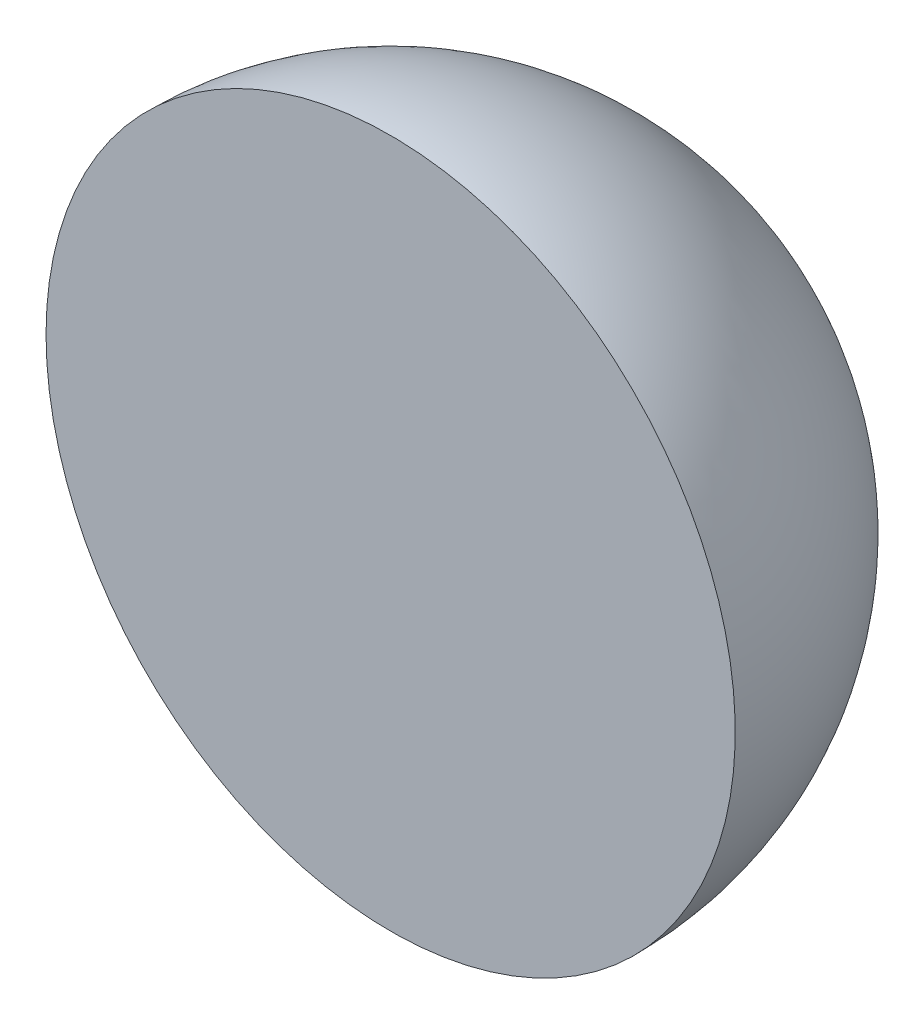
from build123d import *


with BuildPart() as part:
    # ｽｹｯﾁ1 → 回転2 (revolve)
    with BuildSketch(Plane(origin=(0, 0, 0), x_dir=(1, 0, 0), z_dir=(0, 1, 0))):
        with BuildLine():
            Line((-7.0145e-05, 9.3258e-05), (4.999929855, 9.3258e-05))
            ThreePointArc((4.999929855, 9.3258e-05), (3.535426534, 3.535542078), (-7.0145e-05, 4.999929855))
            Line((-7.0145e-05, 4.999929855), (-7.0145e-05, 9.3258e-05))
        make_face()
    revolve(axis=Axis((-7.0145e-05, 0, -4.999929855), (0, 0, 1)))


solid = part.part
